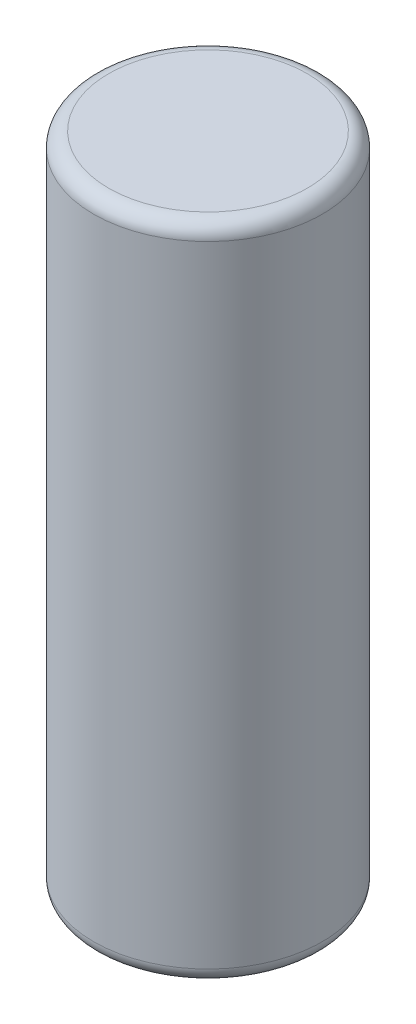
from build123d import *

# Parameters (mm, degrees)
SKETCH2_R           = 76.2
BOSS_EXTRUDE1_DEPTH = 440
FILLET1_R           = 10


with BuildPart() as part:
    # Sketch2 → Boss-Extrude1 (new body)
    with BuildSketch(Plane(origin=(0, 0, 0), x_dir=(1, 0, 0), z_dir=(0, 1, 0))):
        Circle(SKETCH2_R)
    extrude(amount=BOSS_EXTRUDE1_DEPTH)

    # Fillet1
    fillet1_edges = [part.edges().sort_by_distance(p)[0] for p in [
        (-76.2, 0, 0),
        (-76.2, 440, 0),
    ]]
    fillet(fillet1_edges, radius=FILLET1_R)


solid = part.part
